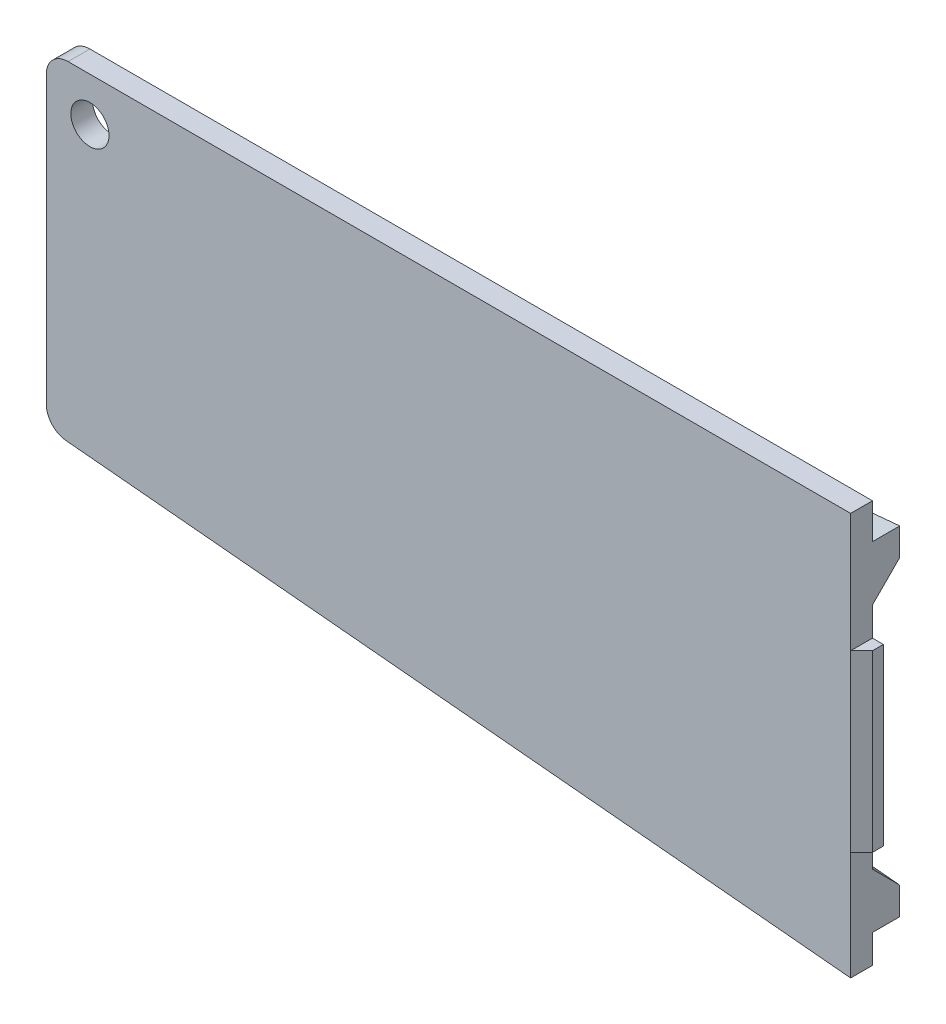
from build123d import *

# Parameters (mm, degrees)
BOSS_EXTRUDE1_DEPTH = 2
BOSS_EXTRUDE2_DEPTH = 8
BOSS_EXTRUDE3_DEPTH = 2.5
CHAMFER1_SIZE       = 2.5
SKETCH5_R           = 1.75
CUT_EXTRUDE1_DEPTH  = 123.114698641


with BuildPart() as part:
    # Sketch1 → Boss-Extrude1 (new body)
    with BuildSketch(Plane.XY):
        with BuildLine():
            Line((-43, -35.867648288), (-43, 1))
            Line((-43, 1), (-114.701591379, 1))
            ThreePointArc((-114.701591379, 1), (-116.115804942, 0.414213562), (-116.701591379, -1))
            Line((-116.701591379, -1), (-116.701591379, -4.677699552))
            Line((-116.701591379, -4.677699552), (-116.701591379, -27.177699552))
            ThreePointArc((-116.701591379, -27.177699552), (-116.179955267, -28.524711139), (-114.887151163, -29.169072838))
            Line((-114.887151163, -29.169072838), (-43, -35.867648288))
        make_face()
    extrude(amount=BOSS_EXTRUDE1_DEPTH)

    # Sketch3 → Boss-Extrude2 (add, symmetric)
    with BuildSketch(Plane(origin=(0, -17.899660586, 0), x_dir=(-1, 0, 0), z_dir=(0, -1, 0))):
        Polygon((42, -1), (42, 0), (43, 0), (43, -2), align=None)
    extrude(amount=BOSS_EXTRUDE2_DEPTH, both=True)

    # Sketch4 → Boss-Extrude3 (add)
    with BuildSketch(Plane(origin=(0, 0, 0), x_dir=(-1, 0, 0), z_dir=(0, 0, -1))):
        with BuildLine():
            Line((114.100916052, -24.89988692), (114.100916052, -10.60011308))
            ThreePointArc((114.100916052, -10.60011308), (113.605361745, -9.320452072), (112.377197846, -8.708308458))
            Line((112.377197846, -8.708308458), (43, -2.243615022))
            Line((43, -2.243615022), (43, -4.754445128))
            Line((43, -4.754445128), (111.600916052, -11.146803215))
            Line((111.600916052, -11.146803215), (111.600916052, -24.353196785))
            Line((111.600916052, -24.353196785), (43, -30.745554872))
            Line((43, -30.745554872), (43, -33.256384978))
            Line((43, -33.256384978), (112.377197846, -26.791691542))
            ThreePointArc((112.377197846, -26.791691542), (113.605361745, -26.179547928), (114.100916052, -24.89988692))
        make_face()
    extrude(amount=BOSS_EXTRUDE3_DEPTH)

    # Chamfer1
    chamfer1_edges = [part.edges().sort_by_distance(p)[0] for p in [
        (-77.300458026, -27.549375828, 0),
        (-111.600916052, -17.75, 0),
        (-77.300458026, -7.950624172, 0),
    ]]
    chamfer(chamfer1_edges, length=CHAMFER1_SIZE - 0.0001)  # a hair under: the kernel refuses the full size

    # Sketch5 → Cut-Extrude1 (cut, through all)
    with BuildSketch(Plane(origin=(0, 0, 0), x_dir=(-1, 0, 0), z_dir=(0, 0, -1))):
        with Locations((112.701591379, -3)):
            Circle(SKETCH5_R)
    extrude(amount=-CUT_EXTRUDE1_DEPTH, mode=Mode.SUBTRACT)


solid = part.part
